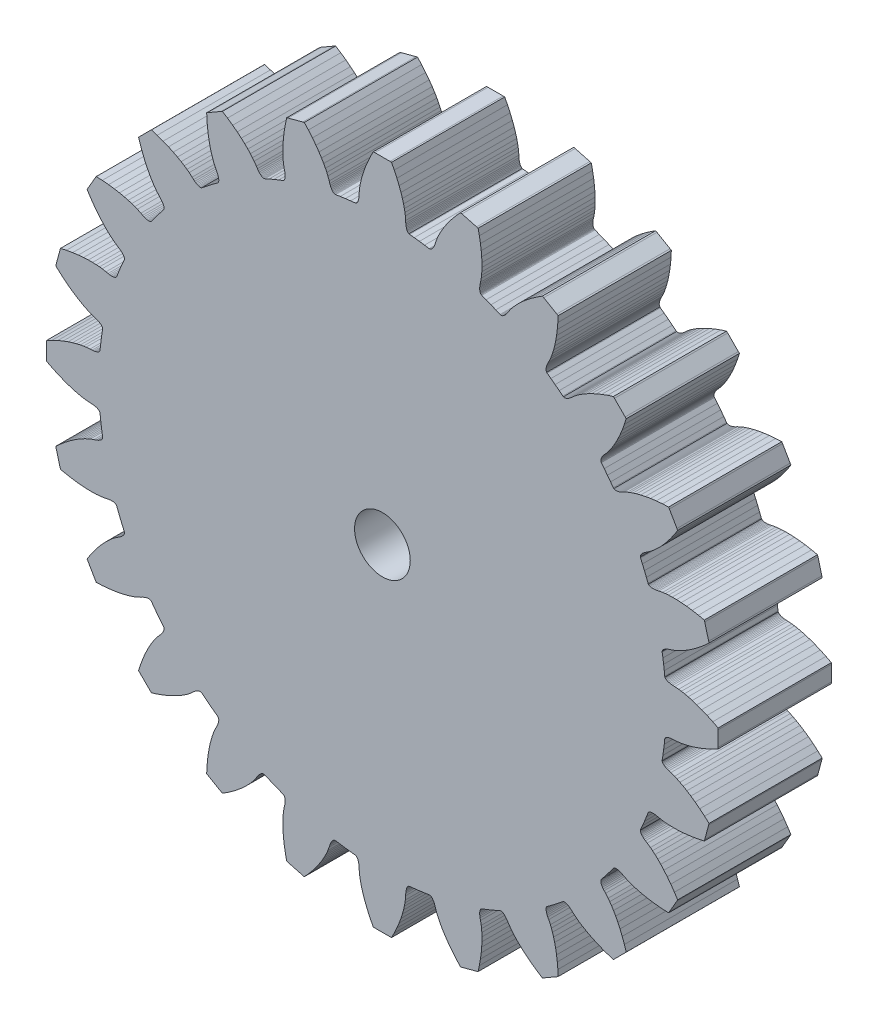
from build123d import *

# Parameters (mm, degrees)
SKETCH2_R           = 1.25
BOSS_EXTRUDE1_DEPTH = 5.08


with BuildPart() as part:
    # Sketch2 → Boss-Extrude1 (new body)
    with BuildSketch(Plane.XY):
        Polygon((14.917584676, 19.003207763), (14.700537092, 18.821891507), (14.49539995, 18.663817961), (14.302173251, 18.527599498), (14.123400974, 18.412773578), (13.958389305, 18.316218047), (13.810260399, 18.237239091), (13.681095694, 18.175721075), (13.568235576, 18.127385492), (13.403802084, 18.068411455), (13.315225392, 18.040774602), (13.255095001, 18.018225705), (13.201787097, 17.99440482), (13.155301679, 17.969311945), (13.115176207, 17.943525258), (13.081873221, 17.917160394), (13.054930181, 17.890217354), (13.034809627, 17.86385249), (13.02174283, 17.837487626), (13.014804708, 17.811122763), (13.015382885, 17.78047939), (13.047992059, 17.573492083), (13.080601232, 17.341874442), (13.108931897, 17.110488073), (13.130902617, 16.902113141), (13.138418916, 16.871469769), (13.151601348, 16.84822706), (13.171721902, 16.826140705), (13.198086765, 16.806135786), (13.230695939, 16.787287221), (13.269549422, 16.770404458), (13.315225392, 16.755950037), (13.366798766, 16.743461417), (13.424500814, 16.734673129), (13.487984631, 16.728313184), (13.580724195, 16.724612852), (13.755217964, 16.710274067), (13.876288194, 16.692581856), (14.017247707, 16.666216992), (14.181103022, 16.628635497), (14.364963256, 16.577871571), (14.567556419, 16.512537589), (14.789576324, 16.431592832), (15.028594628, 16.33179951), (15.284611331, 16.212695082), (15.525479801, 16.088502697), (15.527445602, 16.020740372), (15.527445602, 15.340573142), (15.525479801, 15.272348275), (15.284611331, 15.148618432), (15.028594628, 15.029514004), (14.789576324, 14.929720682), (14.567556419, 14.848197748), (14.364963256, 14.783557578), (14.181103022, 14.732678017), (14.017247707, 14.695096522), (13.876288194, 14.668731658), (13.755217964, 14.651155083), (13.580724195, 14.636816297), (13.487984631, 14.63300033), (13.424500814, 14.626640385), (13.366798766, 14.617389555), (13.315225392, 14.605363477), (13.269549422, 14.590909056), (13.230695939, 14.574026293), (13.198086765, 14.555177728), (13.171721902, 14.534478997), (13.151601348, 14.512508277), (13.138418916, 14.489381204), (13.130902617, 14.459200373), (13.108931897, 14.250941077), (13.080601232, 14.018745259), (13.047992059, 13.787937066), (13.015382885, 13.580949759), (13.014804708, 13.549496939), (13.02174283, 13.523825888), (13.034809627, 13.497461024), (13.054930181, 13.47109616), (13.081873221, 13.44415312), (13.115176207, 13.417788256), (13.155301679, 13.392117204), (13.201787097, 13.36702433), (13.255095001, 13.343087809), (13.315225392, 13.320538912), (13.403802084, 13.292902059), (13.568235576, 13.233928022), (13.681095694, 13.185708074), (13.810260399, 13.123611882), (13.958389305, 13.045095467), (14.123400974, 12.948539936), (14.302173251, 12.833135839), (14.49539995, 12.696917377), (14.700537092, 12.539422007), (14.917584676, 12.357527574), (15.117749496, 12.175633141), (15.101329274, 12.109720982), (14.925794787, 11.452218284), (14.906368045, 11.386999937), (14.642141231, 11.329876065), (14.363691267, 11.280962305), (14.107096387, 11.246502966), (13.871084602, 11.225110423), (13.659124974, 11.215165781), (13.467864077, 11.213893792), (13.30030843, 11.219559925), (13.157267481, 11.230776556), (13.035503439, 11.245230977), (12.863669283, 11.276568161), (12.772548614, 11.296688715), (12.70998988, 11.307327169), (12.651709655, 11.312993302), (12.598864292, 11.314843468), (12.551338156, 11.31229949), (12.509246883, 11.306748992), (12.472706107, 11.296688715), (12.442062734, 11.283506283), (12.41696986, 11.267779873), (12.398005659, 11.248353132), (12.383088697, 11.221410091), (12.307810073, 11.025639414), (12.220621006, 10.809170007), (12.129731608, 10.594666401), (12.044277071, 10.402711691), (12.035604419, 10.373224672), (12.035604419, 10.346165996), (12.041848728, 10.31737279), (12.054337348, 10.286035606), (12.073185913, 10.253426432), (12.098163152, 10.219545269), (12.130194149, 10.184392118), (12.169163268, 10.147966977), (12.214376696, 10.11096366), (12.266412612, 10.073948779), (12.344697755, 10.02438746), (12.488432517, 9.924640392), (12.584525507, 9.84871421), (12.693569658, 9.755870574), (12.816605689, 9.641067781), (12.95085835, 9.504930264), (13.093783664, 9.34745802), (13.245034724, 9.166153328), (13.402530094, 8.960380192), (13.564419609, 8.728889751), (13.71116089, 8.501145895), (13.678551716, 8.441547427), (13.338583736, 7.853079043), (13.303430585, 7.794741), (13.032496919, 7.807287437), (12.751387342, 7.832380312), (12.49409865, 7.865637044), (12.261440291, 7.906410074), (12.053759171, 7.950952818), (11.868742584, 7.999265274), (11.708125059, 8.048826592), (11.572600408, 8.096503054), (11.459046478, 8.141670229), (11.300857295, 8.216335985), (11.218756185, 8.259618303), (11.160244689, 8.285971604), (11.105896066, 8.306670334), (11.054900869, 8.321726059), (11.008531087, 8.331763209), (10.966439813, 8.336781784), (10.928858319, 8.336781784), (10.895555333, 8.33238764), (10.867340304, 8.323599352), (10.84421323, 8.309804053), (10.822820687, 8.287220465), (10.699784656, 8.11783778), (10.559287685, 7.931502949), (10.415668559, 7.747688969), (10.283266064, 7.58457372), (10.267655289, 7.55822042), (10.26013899, 7.53186712), (10.258867001, 7.502391665), (10.262682968, 7.469134933), (10.27262761, 7.432756046), (10.28835402, 7.393231878), (10.310209104, 7.351186858), (10.337845957, 7.306031248), (10.372305297, 7.258967653), (10.413124581, 7.209406335), (10.475914586, 7.141031142), (10.588890339, 7.007402912), (10.662203162, 6.909529137), (10.743147919, 6.790968195), (10.832187152, 6.648540113), (10.926892518, 6.48292714), (11.024257497, 6.293458591), (11.123357007, 6.078908731), (11.222456516, 5.839878863), (11.319127683, 5.574495695), (11.401228794, 5.316039086), (11.3541652, 5.267102199), (10.873584613, 4.78654474), (10.824786488, 4.739481145), (10.566225807, 4.821663201), (10.30084264, 4.918288113), (10.061939971, 5.01741075), (9.847320729, 5.116533387), (9.657794362, 5.213782731), (9.492204517, 5.30849966), (9.349741744, 5.397596711), (9.231215493, 5.47851834), (9.133272337, 5.551912108), (8.999713488, 5.664841608), (8.93125735, 5.727585358), (8.881765413, 5.768369952), (8.834701819, 5.802863982), (8.789604025, 5.830466144), (8.747512752, 5.8524253), (8.707965456, 5.86811702), (8.671540315, 5.87815417), (8.638352965, 5.881912319), (8.608865946, 5.880663457), (8.582616718, 5.873124031), (8.556251854, 5.857455439), (8.393090351, 5.725064507), (8.209114482, 5.581399127), (8.022825905, 5.440879028), (7.853651363, 5.317912379), (7.830986831, 5.296589217), (7.817110587, 5.273369636), (7.808322299, 5.245143042), (7.803928155, 5.211886311), (7.803928155, 5.174258562), (7.808900476, 5.132213543), (7.819076388, 5.085797506), (7.833993351, 5.034975762), (7.854692081, 4.980384306), (7.881056945, 4.922046263), (7.924420208, 4.839864207), (7.999120655, 4.681779097), (8.044218448, 4.568213603), (8.091975855, 4.432712079), (8.141583428, 4.272106118), (8.18968774, 4.087020149), (8.234438627, 3.879385284), (8.275142277, 3.646611289), (8.308445262, 3.389403542), (8.333422502, 3.108351782), (8.346026757, 2.837325608), (8.287746532, 2.80218402), (7.699278148, 2.462158223), (7.639725934, 2.429537486), (7.41192426, 2.576348148), (7.18030662, 2.738202972), (6.974591302, 2.895675215), (6.793275046, 3.046868457), (6.635895311, 3.189909407), (6.499676848, 3.324150504), (6.384850929, 3.447128717), (6.291995729, 3.556276941), (6.216023293, 3.652265859), (6.116345606, 3.795931239), (6.066853669, 3.874355145), (6.029734716, 3.926425751), (5.992847034, 3.971604489), (5.956421893, 4.010492663), (5.921153106, 4.042488969), (5.887271944, 4.067581844), (5.85466277, 4.086395718), (5.823441221, 4.098942155), (5.794532379, 4.105221156), (5.767473703, 4.105221156), (5.73810232, 4.096432868), (5.546031975, 4.011128658), (5.331412733, 3.920158314), (5.115174597, 3.83294612), (4.91940392, 3.757655933), (4.892345244, 3.742611771), (4.872918502, 3.723786334), (4.857192092, 3.698705022), (4.844009661, 3.667957578), (4.834065019, 3.631567128), (4.828398886, 3.589533672), (4.825854908, 3.54185721), (4.827820709, 3.489162173), (4.833371207, 3.430812567), (4.844009661, 3.36808038), (4.864130214, 3.277110037), (4.895583034, 3.1052065), (4.90992182, 2.983500276), (4.921254086, 2.840459327), (4.926920219, 2.672949934), (4.92564823, 2.481608092), (4.915703588, 2.269555955), (4.894311045, 2.033682933), (4.85973607, 1.77707649), (4.81082231, 1.498522454), (4.753814074, 1.234411275), (4.688595727, 1.214961406), (4.031093029, 1.039311284), (3.96518087, 1.022995133), (3.783286437, 1.223125263), (3.601276369, 1.440195975), (3.443896634, 1.645333116), (3.307678172, 1.838559815), (3.19215844, 2.017366783), (3.095718544, 2.182366889), (3.017086494, 2.330414849), (2.955105937, 2.459648936), (2.906770354, 2.572566872), (2.847911952, 2.73695411), (2.820275099, 2.825415166), (2.797610567, 2.885638065), (2.773789681, 2.938957533), (2.748581171, 2.985385133), (2.72291012, 3.025545296), (2.696545256, 3.058790464), (2.669602215, 3.085768195), (2.643237352, 3.105842495), (2.616872488, 3.119013363), (2.591201436, 3.125916794), (2.559864252, 3.1252808), (2.352876945, 3.092660063), (2.121953116, 3.060039326), (1.889872934, 3.031801169), (1.681498002, 3.009853576), (1.651317172, 3.00231415), (1.628190098, 2.989143282), (1.606219378, 2.969068982), (1.585520648, 2.942715682), (1.566672083, 2.910094945), (1.549904955, 2.871195208), (1.535450534, 2.825415166), (1.52330882, 2.773957427), (1.514057991, 2.716243815), (1.507813681, 2.652875634), (1.503882078, 2.560031998), (1.489658928, 2.385630737), (1.471966717, 2.264548944), (1.445601853, 2.123392851), (1.408020359, 1.959641608), (1.357140797, 1.775827628), (1.292616263, 1.573188211), (1.210977693, 1.351110488), (1.111300007, 1.11208062), (0.992079943, 0.856110171), (0.868465736, 0.615207011), (0.800125234, 0.613322154), (0.119958004, 0.613322154), (0.052195678, 0.615207011), (-0.071881071, 0.856110171), (-0.191101134, 1.11208062), (-0.290778821, 1.351110488), (-0.371723578, 1.573188211), (-0.437173196, 1.775827628), (-0.487937122, 1.959641608), (-0.525518616, 2.123392851), (-0.55188348, 2.264548944), (-0.569460056, 2.385630737), (-0.583914477, 2.560031998), (-0.587614808, 2.652875634), (-0.593859118, 2.716243815), (-0.602647406, 2.773957427), (-0.615251661, 2.825415166), (-0.629706082, 2.871195208), (-0.646588846, 2.910094945), (-0.665437411, 2.942715682), (-0.685442329, 2.969068982), (-0.707528684, 2.989143282), (-0.730655758, 3.00231415), (-0.761414765, 3.009853576), (-0.969674062, 3.031801169), (-1.201176067, 3.060039326), (-1.432678072, 3.092660063), (-1.639665379, 3.1252808), (-1.670424387, 3.125916794), (-1.696789251, 3.119013363), (-1.723154115, 3.105842495), (-1.749518978, 3.085768195), (-1.776462019, 3.058790464), (-1.802826883, 3.025545296), (-1.828613569, 2.985385133), (-1.853706444, 2.938957533), (-1.87752733, 2.885638065), (-1.900076226, 2.825415166), (-1.927713079, 2.73695411), (-1.986687116, 2.572566872), (-2.034907065, 2.459648936), (-2.09642508, 2.330414849), (-2.175519671, 2.182366889), (-2.272075203, 2.017366783), (-2.386901122, 1.838559815), (-2.52300395, 1.645333116), (-2.681193132, 1.440195975), (-2.862393752, 1.223125263), (-3.044981997, 1.022995133), (-3.111472333, 1.039311284), (-3.768396855, 1.214961406), (-3.833037025, 1.234411275), (-3.890739073, 1.498522454), (-3.939652833, 1.77707649), (-3.973533996, 2.033682933), (-3.994810904, 2.269555955), (-4.005449357, 2.481608092), (-4.006721346, 2.672949934), (-4.000477037, 2.840459327), (-3.989838583, 2.983500276), (-3.974805985, 3.1052065), (-3.944046977, 3.277110037), (-3.923348247, 3.36808038), (-3.91328797, 3.430812567), (-3.90704366, 3.489162173), (-3.905771671, 3.54185721), (-3.907621837, 3.589533672), (-3.913866146, 3.631567128), (-3.923926423, 3.667957578), (-3.936530678, 3.698705022), (-3.952835265, 3.723786334), (-3.97168383, 3.742611771), (-3.999205047, 3.757655933), (-4.194975724, 3.83294612), (-4.411445132, 3.920158314), (-4.625948738, 4.011128658), (-4.817325271, 4.096432868), (-4.847390466, 4.105221156), (-4.874449142, 4.105221156), (-4.903242348, 4.098942155), (-4.934001356, 4.086395718), (-4.96661053, 4.067581844), (-5.001069869, 4.042488969), (-5.036269275, 4.010492663), (-5.072636598, 3.971604489), (-5.109038611, 3.926425751), (-5.146677923, 3.874355145), (-5.196239242, 3.795931239), (-5.295997873, 3.652265859), (-5.371264934, 3.556276941), (-5.464744565, 3.447128717), (-5.579558921, 3.324150504), (-5.715060444, 3.189909407), (-5.872532687, 3.046868457), (-6.05446181, 2.895675215), (-6.259622079, 2.738202972), (-6.491124084, 2.576348148), (-6.719469244, 2.429537486), (-6.779692143, 2.462158223), (-7.368160527, 2.80218402), (-7.425885702, 2.837325608), (-7.412714834, 3.108351782), (-7.388234826, 3.389403542), (-7.354365227, 3.646611289), (-7.314216628, 3.879385284), (-7.26903789, 4.087020149), (-7.220725433, 4.272106118), (-7.171811673, 4.432712079), (-7.124123648, 4.568213603), (-7.07894491, 4.681779097), (-7.00430228, 4.839864207), (-6.961019962, 4.922046263), (-6.934655098, 4.980384306), (-6.913956368, 5.034975762), (-6.898264648, 5.085797506), (-6.888227499, 5.132213543), (-6.883220487, 5.174258562), (-6.883220487, 5.211886311), (-6.888227499, 5.245143042), (-6.897015786, 5.273369636), (-6.910822649, 5.296589217), (-6.932781806, 5.317912379), (-7.102800486, 5.440879028), (-7.28911219, 5.581399127), (-7.472937733, 5.725064507), (-7.636052982, 5.857455439), (-7.662394719, 5.873124031), (-7.688123588, 5.880663457), (-7.718235037, 5.881912319), (-7.750855774, 5.87815417), (-7.787246225, 5.86811702), (-7.826770393, 5.8524253), (-7.86942828, 5.830466144), (-7.914607018, 5.802863982), (-7.961647485, 5.768369952), (-8.011208804, 5.727585358), (-8.07959556, 5.664841608), (-8.212587796, 5.551912108), (-8.311086002, 5.47851834), (-8.429034076, 5.397596711), (-8.571450594, 5.30849966), (-8.737699562, 5.213782731), (-8.926532116, 5.116533387), (-9.14109354, 5.01741075), (-9.380747839, 4.918288113), (-9.646119443, 4.821663201), (-9.903963185, 4.739481145), (-9.953524503, 4.78654474), (-10.434717957, 5.267102199), (-10.481133993, 5.316039086), (-10.398951938, 5.574495695), (-10.301702594, 5.839878863), (-10.203227515, 6.078908731), (-10.103468884, 6.293458591), (-10.00621954, 6.48292714), (-9.912127042, 6.648540113), (-9.823041555, 6.790968195), (-9.742108361, 6.909529137), (-9.66870303, 7.007402912), (-9.555773531, 7.141031142), (-9.492416913, 7.209406335), (-9.452268314, 7.258967653), (-9.417751156, 7.306031248), (-9.390160558, 7.351186858), (-9.368189838, 7.393231878), (-9.352509682, 7.432756046), (-9.342472532, 7.469134933), (-9.338702819, 7.502391665), (-9.339974808, 7.53186712), (-9.346866676, 7.55822042), (-9.363182827, 7.58457372), (-9.494926201, 7.747688969), (-9.638580017, 7.931502949), (-9.779111679, 8.11783778), (-9.902714323, 8.287220465), (-9.924049048, 8.309804053), (-9.947245503, 8.323599352), (-9.97548366, 8.33238764), (-10.008104397, 8.336781784), (-10.046379703, 8.336781784), (-10.088401596, 8.331763209), (-10.134840759, 8.321726059), (-10.18565094, 8.306670334), (-10.240230833, 8.285971604), (-10.298568876, 8.259618303), (-10.380750931, 8.216335985), (-10.538859169, 8.141670229), (-10.652401536, 8.096503054), (-10.787914623, 8.048826592), (-10.948520584, 7.999265274), (-11.132958995, 7.950952818), (-11.341252982, 7.906410074), (-11.574003849, 7.865637044), (-11.830598729, 7.832380312), (-12.112286483, 7.807287437), (-12.382676663, 7.794741), (-12.418431118, 7.853079043), (-12.759081346, 8.441547427), (-12.791077652, 8.501145895), (-12.644290117, 8.728889751), (-12.48242373, 8.960380192), (-12.324951487, 9.166153328), (-12.173133814, 9.34745802), (-12.030104428, 9.504930264), (-11.896464634, 9.641067781), (-11.773497984, 9.755870574), (-11.664338198, 9.84871421), (-11.568360843, 9.924640392), (-11.424683899, 10.02438746), (-11.346259993, 10.073948779), (-11.294189387, 10.11096366), (-11.249033776, 10.147966977), (-11.210134039, 10.184392118), (-11.178137733, 10.219545269), (-11.152408864, 10.253426432), (-11.133583426, 10.286035606), (-11.121048552, 10.31737279), (-11.114769552, 10.346165996), (-11.115393983, 10.373224672), (-11.123546276, 10.402711691), (-11.209509608, 10.594666401), (-11.300468388, 10.809170007), (-11.387680582, 11.025639414), (-11.462959206, 11.221410091), (-11.478026494, 11.248353132), (-11.496828805, 11.267779873), (-11.521308812, 11.283506283), (-11.552044693, 11.296688715), (-11.589059574, 11.306748992), (-11.63109303, 11.31229949), (-11.678781055, 11.314843468), (-11.731476092, 11.312993302), (-11.789189704, 11.307327169), (-11.852557885, 11.296688715), (-11.942892234, 11.276568161), (-12.115408638, 11.245230977), (-12.236490431, 11.230776556), (-12.380155812, 11.219559925), (-12.547665204, 11.213893792), (-12.738382616, 11.215165781), (-12.951059183, 11.225110423), (-13.186330901, 11.246502966), (-13.443538648, 11.280962305), (-13.72145669, 11.329876065), (-13.986203863, 11.386999937), (-14.005653732, 11.452218284), (-14.181951413, 12.109720982), (-14.197620005, 12.175633141), (-13.996865444, 12.357527574), (-13.780430727, 12.539422007), (-13.575282022, 12.696917377), (-13.382055324, 12.833135839), (-13.203248355, 12.948539936), (-13.038259813, 13.045095467), (-12.890200289, 13.123611882), (-12.760341772, 13.185708074), (-12.648048267, 13.233928022), (-12.483684156, 13.292902059), (-12.394598669, 13.320538912), (-12.334988637, 13.343087809), (-12.281669169, 13.36702433), (-12.235241569, 13.392117204), (-12.19509297, 13.417788256), (-12.161847802, 13.44415312), (-12.134858507, 13.47109616), (-12.114784207, 13.497461024), (-12.100988908, 13.523825888), (-12.094709908, 13.549496939), (-12.095334339, 13.580949759), (-12.127955076, 13.787937066), (-12.160587376, 14.018745259), (-12.188813969, 14.250941077), (-12.210784689, 14.459200373), (-12.218300988, 14.489381204), (-12.23148342, 14.512508277), (-12.25155772, 14.534478997), (-12.277899456, 14.555177728), (-12.310520193, 14.574026293), (-12.349419931, 14.590909056), (-12.394598669, 14.605363477), (-12.44603328, 14.617389555), (-12.503758456, 14.626640385), (-12.567739504, 14.63300033), (-12.660583141, 14.636816297), (-12.834371534, 14.651155083), (-12.956077758, 14.668731658), (-13.09660942, 14.695096522), (-13.2603491, 14.732678017), (-13.44478751, 14.783557578), (-13.647438491, 14.848197748), (-13.868891783, 14.929720682), (-14.108546082, 15.029514004), (-14.364504967, 15.148618432), (-14.605408128, 15.272348275), (-14.607292984, 15.340573142), (-14.607292984, 16.020740372), (-14.605408128, 16.088502697), (-14.364504967, 16.212695082), (-14.108546082, 16.33179951), (-13.868891783, 16.431592832), (-13.647438491, 16.512537589), (-13.44478751, 16.577871571), (-13.2603491, 16.628635497), (-13.09660942, 16.666216992), (-12.956077758, 16.692581856), (-12.834371534, 16.710274067), (-12.660583141, 16.724612852), (-12.567739504, 16.728313184), (-12.503758456, 16.734673129), (-12.44603328, 16.743461417), (-12.394598669, 16.755950037), (-12.349419931, 16.770404458), (-12.310520193, 16.787287221), (-12.277899456, 16.806135786), (-12.25155772, 16.826140705), (-12.23148342, 16.84822706), (-12.218300988, 16.871469769), (-12.210784689, 16.902113141), (-12.188813969, 17.110488073), (-12.160587376, 17.341874442), (-12.127955076, 17.573492083), (-12.095334339, 17.78047939), (-12.094709908, 17.811122763), (-12.100988908, 17.837487626), (-12.114784207, 17.86385249), (-12.134858507, 17.890217354), (-12.161847802, 17.917160394), (-12.19509297, 17.943525258), (-12.235241569, 17.969311945), (-12.281669169, 17.99440482), (-12.334988637, 18.018225705), (-12.394598669, 18.040774602), (-12.483684156, 18.068411455), (-12.648048267, 18.127385492), (-12.760341772, 18.175721075), (-12.890200289, 18.237239091), (-13.038259813, 18.316218047), (-13.203248355, 18.412773578), (-13.382055324, 18.527599498), (-13.575282022, 18.663817961), (-13.780430727, 18.821891507), (-13.996865444, 19.003207763), (-14.197620005, 19.185796008), (-14.181951413, 19.252286344), (-14.005653732, 19.90909523), (-13.986203863, 19.9737354), (-13.72145669, 20.031321813), (-13.443538648, 20.080351209), (-13.186330901, 20.114232372), (-12.951059183, 20.135624914), (-12.738382616, 20.146147733), (-12.547665204, 20.147535357), (-12.380155812, 20.141175412), (-12.236490431, 20.130652594), (-12.115408638, 20.115504361), (-11.942892234, 20.084860988), (-11.852557885, 20.064162258), (-11.789189704, 20.053986345), (-11.731476092, 20.047742035), (-11.678781055, 20.046470046), (-11.63109303, 20.048435848), (-11.589059574, 20.054680157), (-11.552044693, 20.064740434), (-11.521308812, 20.077344689), (-11.496828805, 20.093533641), (-11.478026494, 20.11226657), (-11.462959206, 20.139903423), (-11.387680582, 20.3356741), (-11.300468388, 20.552259143), (-11.209509608, 20.766762749), (-11.123546276, 20.958023646), (-11.115393983, 20.988204477), (-11.114769552, 21.015031882), (-11.121048552, 21.043940724), (-11.133583426, 21.074815367), (-11.152408864, 21.107424541), (-11.178137733, 21.141999515), (-11.210134039, 21.176921396), (-11.249033776, 21.213462172), (-11.294189387, 21.249656042), (-11.346259993, 21.287468807), (-11.424683899, 21.336960744), (-11.568360843, 21.436638431), (-11.664338198, 21.51203269), (-11.773497984, 21.605466067), (-11.896464634, 21.720291987), (-12.030104428, 21.855816637), (-12.173133814, 22.013196372), (-12.324951487, 22.19520644), (-12.48242373, 22.400227946), (-12.644290117, 22.631845587), (-12.791077652, 22.860225437), (-12.759081346, 22.920471463), (-12.418431118, 23.508939847), (-12.382676663, 23.566641895), (-12.112286483, 23.553459463), (-11.830598729, 23.529060401), (-11.574003849, 23.495063603), (-11.341252982, 23.45493813), (-11.132958995, 23.409840337), (-10.948520584, 23.361504754), (-10.787914623, 23.312475358), (-10.652401536, 23.264833587), (-10.538859169, 23.219735794), (-10.380750931, 23.145035346), (-10.298568876, 23.101787719), (-10.240230833, 23.075422855), (-10.18565094, 23.054724125), (-10.134840759, 23.038997715), (-10.088401596, 23.029053073), (-10.046379703, 23.023965117), (-10.008104397, 23.023965117), (-9.97548366, 23.029053073), (-9.947245503, 23.037725726), (-9.924049048, 23.051486334), (-9.902714323, 23.073572689), (-9.779111679, 23.243441044), (-9.638580017, 23.429960891), (-9.494926201, 23.61370549), (-9.363182827, 23.776866993), (-9.346866676, 23.803116221), (-9.339974808, 23.828902908), (-9.338702819, 23.859083739), (-9.342472532, 23.891692912), (-9.352509682, 23.928002418), (-9.368189838, 23.967434078), (-9.390160558, 24.010219164), (-9.417751156, 24.055316957), (-9.452268314, 24.102380552), (-9.492416913, 24.151988124), (-9.555773531, 24.220444261), (-9.66870303, 24.353424934), (-9.742108361, 24.451830631), (-9.823041555, 24.569778706), (-9.912127042, 24.712241478), (-10.00621954, 24.878409501), (-10.103468884, 25.067242056), (-10.203227515, 25.281861297), (-10.301702594, 25.521457778), (-10.398951938, 25.786840946), (-10.481133993, 26.044707815), (-10.434717957, 26.094199752), (-9.953524503, 26.57547415), (-9.903963185, 26.621959568), (-9.646119443, 26.539742822), (-9.380747839, 26.442377843), (-9.14109354, 26.343972145), (-8.926532116, 26.244178823), (-8.737699562, 26.147045115), (-8.571450594, 26.052917926), (-8.429034076, 25.963763058), (-8.311086002, 25.882818301), (-8.212587796, 25.809389842), (-8.07959556, 25.696529724), (-8.011208804, 25.633045907), (-7.961647485, 25.592920435), (-7.914607018, 25.558576731), (-7.86942828, 25.530939878), (-7.826770393, 25.508969158), (-7.787246225, 25.493242748), (-7.750855774, 25.483298107), (-7.718235037, 25.479366504), (-7.688123588, 25.480638493), (-7.662394719, 25.487576615), (-7.636052982, 25.503996838), (-7.472937733, 25.635705521), (-7.28911219, 25.779440282), (-7.102800486, 25.919937253), (-6.932781806, 26.043435826), (-6.910822649, 26.064828369), (-6.897015786, 26.087955442), (-6.888227499, 26.116170472), (-6.883220487, 26.148779645), (-6.883220487, 26.187170587), (-6.888227499, 26.229146225), (-6.898264648, 26.275516008), (-6.913956368, 26.326395569), (-6.934655098, 26.380975463), (-6.961019962, 26.439371323), (-7.00430228, 26.521588069), (-7.07894491, 26.679545981), (-7.124123648, 26.793099911), (-7.171811673, 26.928740197), (-7.220725433, 27.089242087), (-7.26903789, 27.273680497), (-7.314216628, 27.481939794), (-7.354365227, 27.714713788), (-7.388234826, 27.971308668), (-7.412714834, 28.252996422), (-7.425885702, 28.523351911), (-7.368160527, 28.559198875), (-6.779692143, 28.899745031), (-6.719469244, 28.931776028), (-6.491124084, 28.784919112), (-6.259622079, 28.623260868), (-6.05446181, 28.465649863), (-5.872532687, 28.313936261), (-5.715060444, 28.170779676), (-5.579558921, 28.037220827), (-5.464744565, 27.914300432), (-5.371264934, 27.805140645), (-5.295997873, 27.709047655), (-5.196239242, 27.565544164), (-5.146677923, 27.486912115), (-5.109038611, 27.434876199), (-5.072636598, 27.389778406), (-5.036269275, 27.350924923), (-5.001069869, 27.318778291), (-4.96661053, 27.293107239), (-4.934001356, 27.274258674), (-4.903242348, 27.261770055), (-4.874449142, 27.255525745), (-4.847390466, 27.256103922), (-4.817325271, 27.264314033), (-4.625948738, 27.350231111), (-4.411445132, 27.441236145), (-4.194975724, 27.528425211), (-3.999205047, 27.603703836), (-3.97168383, 27.618852069), (-3.952835265, 27.637584998), (-3.936530678, 27.661984061), (-3.923926423, 27.692858704), (-3.913866146, 27.729746386), (-3.907621837, 27.771837659), (-3.905771671, 27.819595066), (-3.90704366, 27.872209158), (-3.91328797, 27.929911206), (-3.923348247, 27.993279388), (-3.944046977, 28.083590609), (-3.974805985, 28.256118577), (-3.989838583, 28.377188807), (-4.000477037, 28.520923568), (-4.006721346, 28.688479215), (-4.005449357, 28.879046301), (-3.994810904, 29.091931012), (-3.973533996, 29.327017713), (-3.939652833, 29.584306405), (-3.890739073, 29.862178193), (-3.833037025, 30.126983184), (-3.768396855, 30.146409925), (-3.111472333, 30.32275386), (-3.044981997, 30.338364635), (-2.862393752, 30.137621637), (-2.681193132, 29.921267865), (-2.52300395, 29.716015089), (-2.386901122, 29.52278839), (-2.272075203, 29.344016112), (-2.175519671, 29.179120079), (-2.09642508, 29.030991173), (-2.034907065, 28.901132656), (-1.986687116, 28.788850714), (-1.927713079, 28.624301587), (-1.900076226, 28.535377989), (-1.87752733, 28.475825775), (-1.853706444, 28.422517871), (-1.828613569, 28.376032453), (-1.802826883, 28.335906981), (-1.776462019, 28.30248836), (-1.749518978, 28.275660954), (-1.723154115, 28.255656036), (-1.696789251, 28.241779792), (-1.670424387, 28.235535482), (-1.639665379, 28.235998023), (-1.432678072, 28.268722832), (-1.201176067, 28.301332006), (-0.969674062, 28.3294314), (-0.761414765, 28.351517755), (-0.730655758, 28.359034054), (-0.707528684, 28.372216486), (-0.685442329, 28.39233704), (-0.665437411, 28.418586268), (-0.646588846, 28.451195442), (-0.629706082, 28.490048925), (-0.615251661, 28.535377989), (-0.602647406, 28.586720092), (-0.593859118, 28.64442214), (-0.587614808, 28.708484134), (-0.583914477, 28.801339334), (-0.569460056, 28.975139291), (-0.55188348, 29.096903332), (-0.525518616, 29.237400304), (-0.487937122, 29.401024348), (-0.437173196, 29.585578394), (-0.371723578, 29.788055922), (-0.290778821, 30.009613286), (-0.191101134, 30.249325402), (-0.071881071, 30.50522647), (0.052195678, 30.74609494), (0.119958004, 30.748060741), (0.800125234, 30.748060741), (0.868465736, 30.74609494), (0.992079943, 30.50522647), (1.111300007, 30.249325402), (1.210977693, 30.009613286), (1.292616263, 29.788055922), (1.357140797, 29.585578394), (1.408020359, 29.401024348), (1.445601853, 29.237400304), (1.471966717, 29.096903332), (1.489658928, 28.975139291), (1.503882078, 28.801339334), (1.507813681, 28.708484134), (1.514057991, 28.64442214), (1.52330882, 28.586720092), (1.535450534, 28.535377989), (1.549904955, 28.490048925), (1.566672083, 28.451195442), (1.585520648, 28.418586268), (1.606219378, 28.39233704), (1.628190098, 28.372216486), (1.651317172, 28.359034054), (1.681498002, 28.351517755), (1.889872934, 28.3294314), (2.121953116, 28.301332006), (2.352876945, 28.268722832), (2.559864252, 28.235998023), (2.591201436, 28.235535482), (2.616872488, 28.241779792), (2.643237352, 28.255656036), (2.669602215, 28.275660954), (2.696545256, 28.30248836), (2.72291012, 28.335906981), (2.748581171, 28.376032453), (2.773789681, 28.422517871), (2.797610567, 28.475825775), (2.820275099, 28.535377989), (2.847911952, 28.624301587), (2.906770354, 28.788850714), (2.955105937, 28.901132656), (3.017086494, 29.030991173), (3.095718544, 29.179120079), (3.19215844, 29.344016112), (3.307678172, 29.52278839), (3.443896634, 29.716015089), (3.601276369, 29.921267865), (3.783286437, 30.137621637), (3.96518087, 30.338364635), (4.031093029, 30.32275386), (4.688595727, 30.146409925), (4.753814074, 30.126983184), (4.81082231, 29.862178193), (4.85973607, 29.584306405), (4.894311045, 29.327017713), (4.915703588, 29.091931012), (4.92564823, 28.879046301), (4.926920219, 28.688479215), (4.921254086, 28.520923568), (4.90992182, 28.377188807), (4.895583034, 28.256118577), (4.864130214, 28.083590609), (4.844009661, 27.993279388), (4.833371207, 27.929911206), (4.827820709, 27.872209158), (4.825854908, 27.819595066), (4.828398886, 27.771837659), (4.834065019, 27.729746386), (4.844009661, 27.692858704), (4.857192092, 27.661984061), (4.872918502, 27.637584998), (4.892345244, 27.618852069), (4.91940392, 27.603703836), (5.115174597, 27.528425211), (5.331412733, 27.441236145), (5.546031975, 27.350231111), (5.73810232, 27.264314033), (5.767473703, 27.256103922), (5.794532379, 27.255525745), (5.823441221, 27.261770055), (5.85466277, 27.274258674), (5.887271944, 27.293107239), (5.921153106, 27.318778291), (5.956421893, 27.350924923), (5.992847034, 27.389778406), (6.029734716, 27.434876199), (6.066853669, 27.486912115), (6.116345606, 27.565544164), (6.216023293, 27.709047655), (6.291995729, 27.805140645), (6.384850929, 27.914300432), (6.499676848, 28.037220827), (6.635895311, 28.170779676), (6.793275046, 28.313936261), (6.974591302, 28.465649863), (7.18030662, 28.623260868), (7.41192426, 28.784919112), (7.639725934, 28.931776028), (7.699278148, 28.899745031), (8.287746532, 28.559198875), (8.346026757, 28.523351911), (8.333422502, 28.252996422), (8.308445262, 27.971308668), (8.275142277, 27.714713788), (8.234438627, 27.481939794), (8.18968774, 27.273680497), (8.141583428, 27.089242087), (8.091975855, 26.928740197), (8.044218448, 26.793099911), (7.999120655, 26.679545981), (7.924420208, 26.521588069), (7.881056945, 26.439371323), (7.854692081, 26.380975463), (7.833993351, 26.326395569), (7.819076388, 26.275516008), (7.808900476, 26.229146225), (7.803928155, 26.187170587), (7.803928155, 26.148779645), (7.808322299, 26.116170472), (7.817110587, 26.087955442), (7.830986831, 26.064828369), (7.853651363, 26.043435826), (8.022825905, 25.919937253), (8.209114482, 25.779440282), (8.393090351, 25.635705521), (8.556251854, 25.503996838), (8.582616718, 25.487576615), (8.608865946, 25.480638493), (8.638352965, 25.479366504), (8.671540315, 25.483298107), (8.707965456, 25.493242748), (8.747512752, 25.508969158), (8.789604025, 25.530939878), (8.834701819, 25.558576731), (8.881765413, 25.592920435), (8.93125735, 25.633045907), (8.999713488, 25.696529724), (9.133272337, 25.809389842), (9.231215493, 25.882818301), (9.349741744, 25.963763058), (9.492204517, 26.052917926), (9.657794362, 26.147045115), (9.847320729, 26.244178823), (10.061939971, 26.343972145), (10.30084264, 26.442377843), (10.566225807, 26.539742822), (10.824786488, 26.621959568), (10.873584613, 26.57547415), (11.3541652, 26.094199752), (11.401228794, 26.044707815), (11.319127683, 25.786840946), (11.222456516, 25.521457778), (11.123357007, 25.281861297), (11.024257497, 25.067242056), (10.926892518, 24.878409501), (10.832187152, 24.712241478), (10.743147919, 24.569778706), (10.662203162, 24.451830631), (10.588890339, 24.353424934), (10.475914586, 24.220444261), (10.413124581, 24.151988124), (10.372305297, 24.102380552), (10.337845957, 24.055316957), (10.310209104, 24.010219164), (10.28835402, 23.967434078), (10.27262761, 23.928002418), (10.262682968, 23.891692912), (10.258867001, 23.859083739), (10.26013899, 23.828902908), (10.267655289, 23.803116221), (10.283266064, 23.776866993), (10.415668559, 23.61370549), (10.559287685, 23.429960891), (10.699784656, 23.243441044), (10.822820687, 23.073572689), (10.84421323, 23.051486334), (10.867340304, 23.037725726), (10.895555333, 23.029053073), (10.928858319, 23.023965117), (10.966439813, 23.023965117), (11.008531087, 23.029053073), (11.054900869, 23.038997715), (11.105896066, 23.054724125), (11.160244689, 23.075422855), (11.218756185, 23.101787719), (11.300857295, 23.145035346), (11.459046478, 23.219735794), (11.572600408, 23.264833587), (11.708125059, 23.312475358), (11.868742584, 23.361504754), (12.053759171, 23.409840337), (12.261440291, 23.45493813), (12.49409865, 23.495063603), (12.751387342, 23.529060401), (13.032496919, 23.553459463), (13.303430585, 23.566641895), (13.338583736, 23.508939847), (13.678551716, 22.920471463), (13.71116089, 22.860225437), (13.564419609, 22.631845587), (13.402530094, 22.400227946), (13.245034724, 22.19520644), (13.093783664, 22.013196372), (12.95085835, 21.855816637), (12.816605689, 21.720291987), (12.693569658, 21.605466067), (12.584525507, 21.51203269), (12.488432517, 21.436638431), (12.344697755, 21.336960744), (12.266412612, 21.287468807), (12.214376696, 21.249656042), (12.169163268, 21.213462172), (12.130194149, 21.176921396), (12.098163152, 21.141999515), (12.073185913, 21.107424541), (12.054337348, 21.074815367), (12.041848728, 21.043940724), (12.035604419, 21.015031882), (12.035604419, 20.988204477), (12.044277071, 20.958023646), (12.129731608, 20.766762749), (12.220621006, 20.552259143), (12.307810073, 20.3356741), (12.383088697, 20.139903423), (12.398005659, 20.11226657), (12.41696986, 20.093533641), (12.442062734, 20.077344689), (12.472706107, 20.064740434), (12.509246883, 20.054680157), (12.551338156, 20.048435848), (12.598864292, 20.046470046), (12.651709655, 20.047742035), (12.70998988, 20.053986345), (12.772548614, 20.064162258), (12.863669283, 20.084860988), (13.035503439, 20.115504361), (13.157267481, 20.130652594), (13.30030843, 20.141175412), (13.467864077, 20.147535357), (13.659124974, 20.146147733), (13.871084602, 20.135624914), (14.107096387, 20.114232372), (14.363691267, 20.080351209), (14.642141231, 20.031321813), (14.906368045, 19.9737354), (14.925794787, 19.90909523), (15.101329274, 19.252286344), (15.117749496, 19.185796008), align=None)
        with Locations((0.460041619, 15.680772392)):
            Circle(SKETCH2_R, mode=Mode.SUBTRACT)
    extrude(amount=BOSS_EXTRUDE1_DEPTH)


solid = part.part
